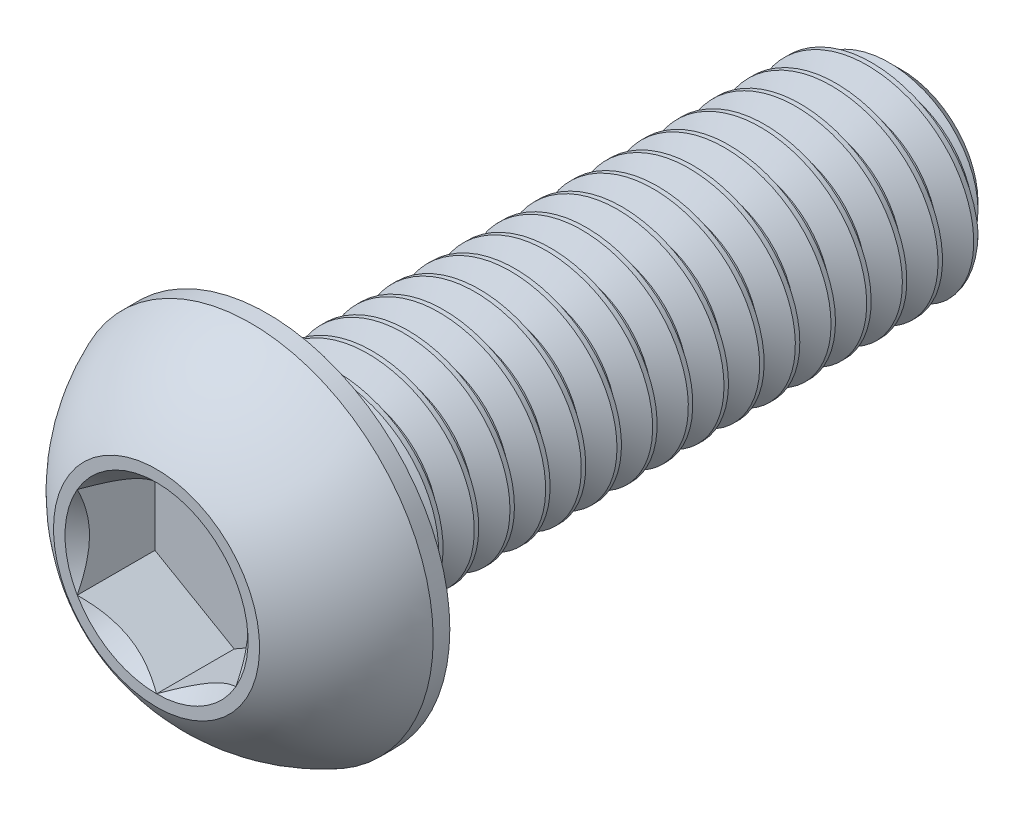
from build123d import *

# Parameters (mm, degrees)
CUT_EXTRUDE2_DEPTH = 0.98
SKETCH6_R          = 1.154700538
CUT_EXTRUDE3_DEPTH = 0.98
CUT_EXTRUDE3_DRAFT = -45
CUT_SWEEP2_PITCH   = 0.45
CUT_SWEEP2_TO      = 8


with BuildPart() as part:
    # Sketch10 → Revolve3 (revolve)
    with BuildSketch(Plane(origin=(0, 0, 0), x_dir=(0, 0, -1), z_dir=(1, 0, 0)), mode=Mode.PRIVATE) as revolve3_sk:
        Polygon((9.0625, 1.3), (9.4, 0.9625), (9.4, 0), (1.4, 0), (1.4, 1.3), align=None)
    revolve(revolve3_sk.sketch.rotate(Axis((0, 0, 0), (0, 0, -1)), 90), axis=Axis((0, 0, 0), (0, 0, -1)))

    # Sketch7 → Revolve2 (revolve)
    with BuildSketch(Plane(origin=(0, 0, 0), x_dir=(0, 0, -1), z_dir=(1, 0, 0)), mode=Mode.PRIVATE) as revolve2_sk:
        with BuildLine():
            Line((1.19, 2.3), (1.4, 2.3))
            Line((1.4, 2.3), (1.4, 0))
            Line((1.4, 0), (0, 0))
            Line((0, 0), (0, 1.3))
            ThreePointArc((0, 1.3), (0.514503032, 1.895791391), (1.19, 2.3))
        make_face()
    revolve(revolve2_sk.sketch.rotate(Axis((0, 0, 0), (0, 0, -1)), 180), axis=Axis((0, 0, 0), (0, 0, -1)))

    # Sketch5 → Cut-Extrude2 (cut)
    with BuildSketch(Plane.XY):
        Polygon((1, -0.577350269), (1, 0.577350269), (0, 1.154700538), (-1, 0.577350269), (-1, -0.577350269), (0, -1.154700538), align=None)
    extrude(amount=-CUT_EXTRUDE2_DEPTH, mode=Mode.SUBTRACT)


with BuildPart() as cut_extrude3_tool:
    # Sketch6 → Cut-Extrude3 (with draft: the straight prism first)
    with BuildSketch(Plane.XY):
        Circle(SKETCH6_R)
    extrude(amount=-CUT_EXTRUDE3_DEPTH)
    # Cut-Extrude3: the draft: its side faces are tilted about the plane it starts from
    cut_extrude3_sides = [cut_extrude3_tool.faces().sort_by_distance(p)[0] for p in [
        (-1.154700538, 0, -0.49),
    ]]
    draft(cut_extrude3_sides, Plane.XY, CUT_EXTRUDE3_DRAFT)


with BuildPart() as part_1:
    add(part.part)

    # Cut-Extrude3: cut by cut_extrude3_tool
    add(cut_extrude3_tool.part, mode=Mode.SUBTRACT)


with BuildPart() as body_2:
    # Split1: read off the stored shape, not the designer's step
    # Split1: the piece on the far side of the plane
    add(part_1.part)
    split(bisect_by=Plane.XY.offset(-1.4), keep=Keep.BOTTOM)

    # Cut-Sweep2: arcs per turn and ends read off the stored shape
    # Cut-Sweep2: the profile of Sketch12 screwed along a right-hand helix through 22 turns, 6 arcs to a turn; built about Z, then put on its axis
    cut_sweep2_z = Axis((0, 0, 0), (0, 0, 1))
    cut_sweep2_corners = [(1.007716426, 0, -0.16875), (1.007716426, 0, -0.225), (1.324356964, 0, -0.4078125), (1.324356964, 0, 0.0140625)]
    with BuildLine(mode=Mode.PRIVATE) as cut_sweep2_profile:
        Line(cut_sweep2_corners[0], cut_sweep2_corners[1])
        Line(cut_sweep2_corners[1], cut_sweep2_corners[2])
        Line(cut_sweep2_corners[2], cut_sweep2_corners[3])
        Line(cut_sweep2_corners[3], cut_sweep2_corners[0])
    cut_sweep2_cap = Face(cut_sweep2_profile.wire())
    cut_sweep2_turn_angles = [0, 30, 60, 90, 120, 150, 180, 210, 240, 270, 300, 330, 360]
    cut_sweep2_turn_weights = [1, 0.8660254037844387, 1, 0.8660254037844387, 1, 0.8660254037844387, 1, 0.8660254037844387, 1, 0.8660254037844387, 1, 0.8660254037844387, 1]
    cut_sweep2_turn_rails = [Edge.make_bspline([Vector(p[0], p[1], 0).rotate(cut_sweep2_z, cut_sweep2_turn_angles[k]) / cut_sweep2_turn_weights[k] + Vector(0, 0, p[2] + CUT_SWEEP2_PITCH * cut_sweep2_turn_angles[k] / 360) for k in range(13)], [0, 0, 0, 1, 1, 2, 2, 3, 3, 4, 4, 5, 5, 6, 6, 6], 2, cut_sweep2_turn_weights) for p in cut_sweep2_corners]
    cut_sweep2_turn_sides = [Face.make_surface_from_curves(cut_sweep2_turn_rails[p[0]], cut_sweep2_turn_rails[p[1]]) for p in [(0, 1), (1, 2), (2, 3), (3, 0)]]
    cut_sweep2 = Plane(origin=(0, 0, -9.4), x_dir=(0, 1, 0), z_dir=(0, 0, 1)) * split(Solid(Shell([*[p.moved(Location((0, 0, CUT_SWEEP2_PITCH * i))) for i in range(22) for p in cut_sweep2_turn_sides], cut_sweep2_cap, cut_sweep2_cap.rotate(cut_sweep2_z, 7920).moved(Location((0, 0, CUT_SWEEP2_PITCH * 7920 / 360)))])), bisect_by=Plane.XY.offset(CUT_SWEEP2_TO), keep=Keep.BOTTOM, mode=Mode.PRIVATE)
    add(cut_sweep2, mode=Mode.SUBTRACT)


with BuildPart() as part_2:
    add(part_1.part)

    # Split1
    split(bisect_by=Plane.XY.offset(-1.4), keep=Keep.TOP)

    add(body_2.part)  # Boss-Extrude1 merges body 2
    # Boss-Extrude1 cone 1 section (through the dimple's axis) → Boss-Extrude1 (revolve)
    with BuildSketch(Plane(origin=(0, 0, -1.4), x_dir=(0, -1, 0), z_dir=(1, 0, 0))):
        Polygon((0, 0), (1.3, 0), (0, 1.3), align=None)
    revolve(axis=Axis((0, 0, -1.4), (0, 0, -1)))


solid = part_2.part
